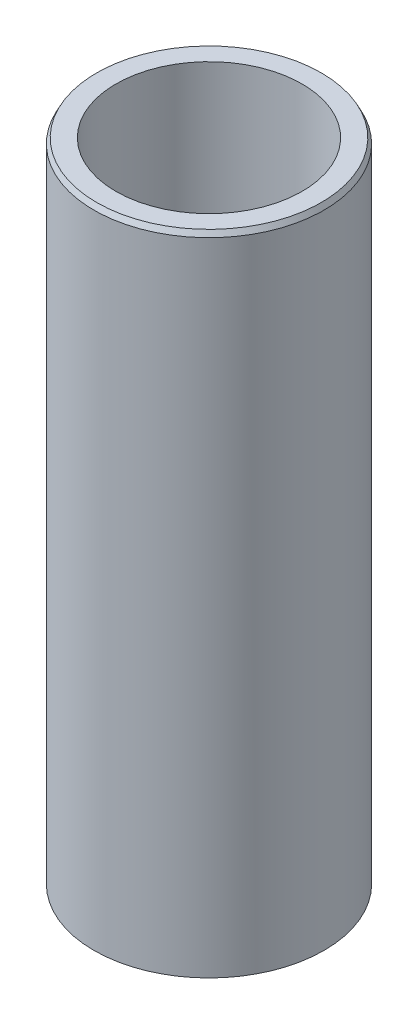
from build123d import *
from OCP.BRepFilletAPI import BRepFilletAPI_MakeChamfer

# Parameters (mm, degrees)
SKETCH1_R           = 32.5
BOSS_EXTRUDE1_DEPTH = 183.426677698
SKETCH2_R           = 26.309978728
CUT_EXTRUDE1_DEPTH  = 190.097451308
CHAMFER1_SIZE       = 1.499283271
CHAMFER1_SIZE2      = 0.761838427


with BuildPart() as part:
    # Sketch1 → Boss-Extrude1 (new body)
    with BuildSketch(Plane(origin=(0, 0, 0), x_dir=(1, 0, 0), z_dir=(0, 1, 0))):
        Circle(SKETCH1_R)
    extrude(amount=BOSS_EXTRUDE1_DEPTH)

    # Sketch2 → Cut-Extrude1 (cut, through all)
    with BuildSketch(Plane(origin=(0, 0, 0), x_dir=(1, 0, 0), z_dir=(0, 1, 0))):
        Circle(SKETCH2_R)
    extrude(amount=CUT_EXTRUDE1_DEPTH, mode=Mode.SUBTRACT)

    # Chamfer1: one chamfer whose edges measure the first distance from different faces: ONE call of the kernel's chamfer builder (chamfer() names one face for all edges)
    chamfer1_edges_1 = [part.edges().sort_by_distance(p)[0] for p in [
        (-32.5, 183.426677698, 0),
    ]]
    chamfer1_side_1 = [part.faces().sort_by_distance(p)[0] for p in [
        (-32.5, 91.713338849, 0),
    ]]
    chamfer1_edges_2 = [part.edges().sort_by_distance(p)[0] for p in [
        (-32.5, 0, 0),
    ]]
    chamfer1_side_2 = [part.faces().sort_by_distance(p)[0] for p in [
        (-31.580761184, 0, 0),
    ]]
    chamfer1 = BRepFilletAPI_MakeChamfer(part.part.solid().wrapped)
    for e in chamfer1_edges_1:
        chamfer1.Add(CHAMFER1_SIZE, CHAMFER1_SIZE2, e.wrapped, chamfer1_side_1[0].wrapped)  # the first distance lies on this face
    for e in chamfer1_edges_2:
        chamfer1.Add(CHAMFER1_SIZE, CHAMFER1_SIZE2, e.wrapped, chamfer1_side_2[0].wrapped)  # the first distance lies on this face
    add(Compound.cast(chamfer1.Shape()), mode=Mode.REPLACE)


solid = part.part
